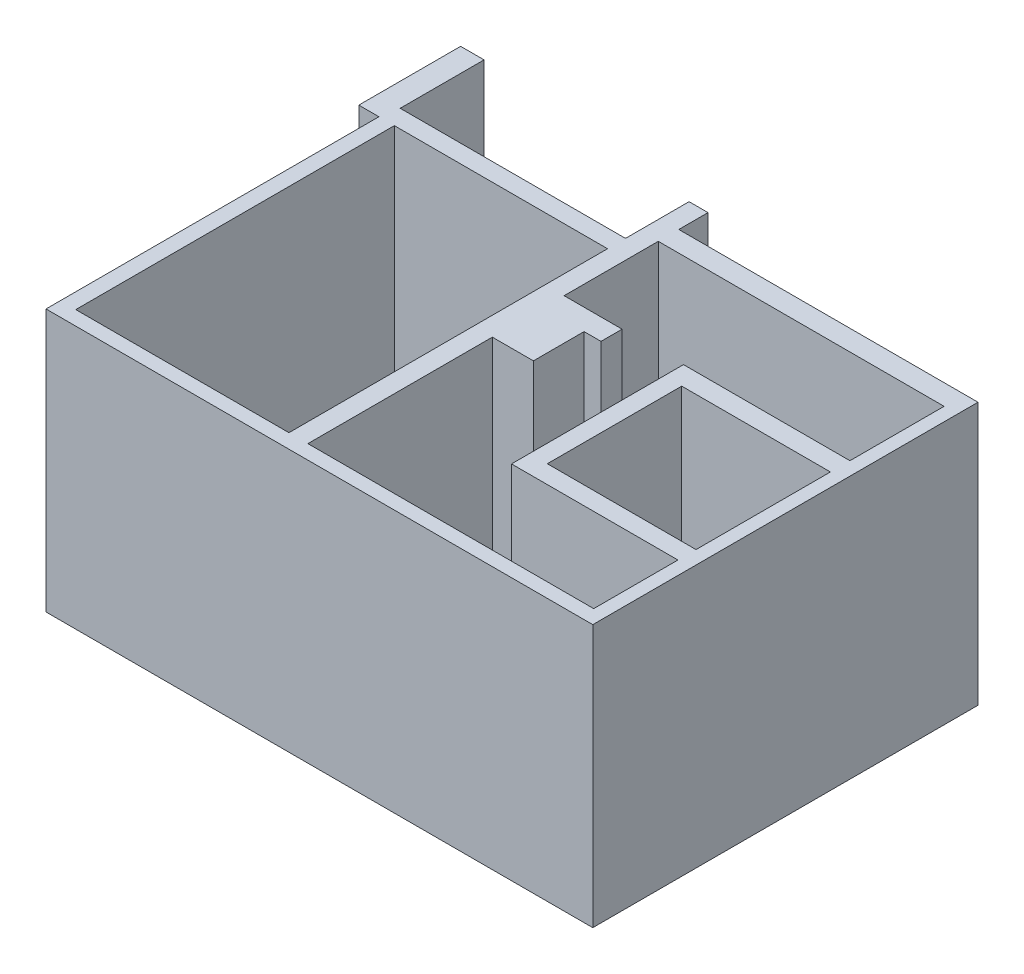
from build123d import *

# Parameters (mm, degrees)
SKETCH_1_W      = 1949.559322321
SKETCH_1_H      = 2913.4204304
SKETCH_1_W_2    = 1359.741102434
SKETCH_1_H_2    = 1229.150522744
EXTRUDE_1_DEPTH = 2400


with BuildPart() as part:
    # Эскиз1 → Бобышка-Вытянуть1 (new body)
    with BuildSketch(Plane(origin=(0, 0, 0), x_dir=(1, 0, 0), z_dir=(0, 1, 0))):
        Polygon((-685.442603647, 1097.0797173), (-685.442603647, 165.893398217), (-501.331088794, 165.893398217), (-501.331088794, -2878.483670923), (4498.668911206, -2878.483670923), (4498.668911206, 644.148270068), (1762.593229145, 644.148270068), (1762.593229145, 911.408345514), (1589.381998898, 911.408345514), (1589.381998898, 330.000462087), (-471.076787698, 330.000462087), (-471.076787698, 1097.0797173), align=None)
        with Locations((614.602337738, -1290.816816983)):
            Rectangle(SKETCH_1_W, SKETCH_1_H, mode=Mode.SUBTRACT)
        Polygon((1762.593229145, 456.59733993), (1762.593229145, -404.51714072), (2292.905038515, -404.51714072), (2292.905038515, -597.577432251), (2138.175521151, -597.577432251), (2138.175521151, -1060.922131924), (1762.593229145, -1060.922131924), (1762.593229145, -2747.527032183), (4376.300203814, -2747.527032183), (4376.300203814, -1977.333330858), (2854.218930153, -1977.333330858), (2854.218930153, -404.51714072), (4376.300203814, -404.51714072), (4376.300203814, 456.59733993), align=None, mode=Mode.SUBTRACT)
        with Locations((3696.429652597, -1197.541863718)):
            Rectangle(SKETCH_1_W_2, SKETCH_1_H_2, mode=Mode.SUBTRACT)
    extrude(amount=EXTRUDE_1_DEPTH)


solid = part.part
